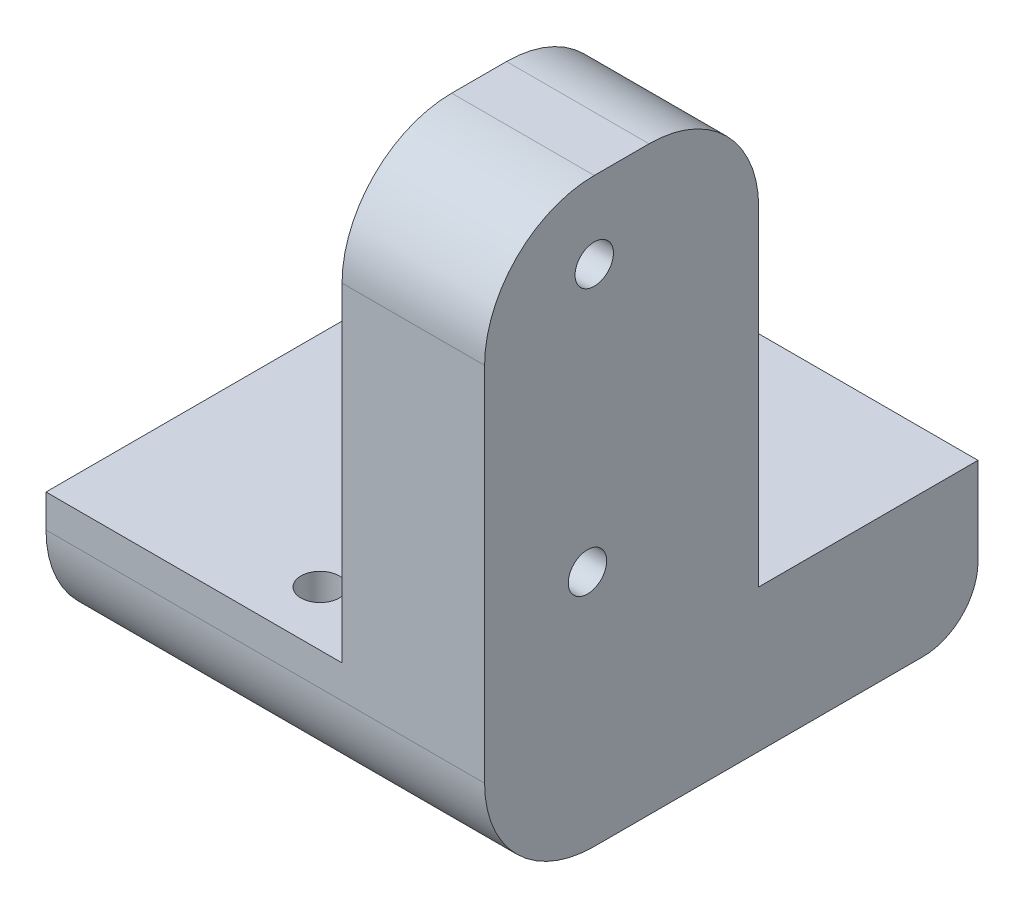
from build123d import *

# Parameters (mm, degrees)
SKETCH1_W           = 40
SKETCH1_H           = 50
BOSS_EXTRUDE1_DEPTH = 13
SKETCH2_W           = 13
SKETCH2_H           = 30
BOSS_EXTRUDE2_DEPTH = 40
SKETCH3_R           = 1.75
CUT_EXTRUDE1_DEPTH  = 32
SKETCH4_W           = 26
SKETCH4_H           = 50
CUT_EXTRUDE2_DEPTH  = 3
SKETCH5_R           = 1.75
CUT_EXTRUDE3_DEPTH  = 10
SKETCH6_W           = 40
SKETCH6_H           = 53
CUT_EXTRUDE4_DEPTH  = 5
FILLET1_R           = 10
FILLET2_R           = 10
FILLET3_R           = 10
FILLET4_R           = 5
SKETCH7_R           = 3.5
CUT_EXTRUDE5_DEPTH  = 5


with BuildPart() as part:
    # Sketch1 → Boss-Extrude1 (new body)
    with BuildSketch(Plane(origin=(0, 0, 0), x_dir=(1, 0, 0), z_dir=(0, 1, 0))):
        Rectangle(SKETCH1_W, SKETCH1_H)
    extrude(amount=BOSS_EXTRUDE1_DEPTH)

    # Sketch2 → Boss-Extrude2 (add)
    with BuildSketch(Plane(origin=(0, 13, 0), x_dir=(1, 0, 0), z_dir=(0, 1, 0))):
        with Locations((13.5, -10)):
            Rectangle(SKETCH2_W, SKETCH2_H)
    extrude(amount=BOSS_EXTRUDE2_DEPTH)

    # Sketch3 → Cut-Extrude1 (cut)
    with BuildSketch(Plane(origin=(20, 0, 0), x_dir=(0, 0, -1), z_dir=(1, 0, 0))):
        with Locations((-10, 46)):
            Circle(SKETCH3_R)
        with Locations((-10.616810137, 22)):
            Circle(SKETCH3_R)
    extrude(amount=-CUT_EXTRUDE1_DEPTH, mode=Mode.SUBTRACT)

    # Sketch4 → Cut-Extrude2 (cut)
    with BuildSketch(Plane(origin=(0, 0, 0), x_dir=(-1, 0, 0), z_dir=(0, -1, 0))):
        Rectangle(SKETCH4_W, SKETCH4_H)
    extrude(amount=-CUT_EXTRUDE2_DEPTH, mode=Mode.SUBTRACT)

    # Sketch5 → Cut-Extrude3 (cut)
    with BuildSketch(Plane(origin=(0, 3, 0), x_dir=(-1, 0, 0), z_dir=(0, -1, 0))):
        with Locations(Location((0, 0, 0), (0, 0, 90))):
            Circle(SKETCH5_R)
        with Locations(Location((0, -15, 0), (0, 0, 90))):
            Circle(SKETCH5_R)
        with Locations(Location((0, 15, 0), (0, 0, 90))):
            Circle(SKETCH5_R)
    extrude(amount=-CUT_EXTRUDE3_DEPTH, mode=Mode.SUBTRACT)

    # Sketch6 → Cut-Extrude4 (cut)
    with BuildSketch(Plane.XY.offset(25)):
        with Locations((0, 26.5)):
            Rectangle(SKETCH6_W, SKETCH6_H)
    extrude(amount=-CUT_EXTRUDE4_DEPTH, mode=Mode.SUBTRACT)

    # Fillet1
    fillet1_edges = [part.edges().sort_by_distance(p)[0] for p in [
        (13.5, 53, 20),
    ]]
    fillet(fillet1_edges, radius=FILLET1_R)

    # Fillet2
    fillet2_edges = [part.edges().sort_by_distance(p)[0] for p in [
        (13.5, 53, -5),
    ]]
    fillet(fillet2_edges, radius=FILLET2_R)

    # Fillet3
    fillet3_edges = [part.edges().sort_by_distance(p)[0] for p in [
        (-16.5, 0, 20),
    ]]
    fillet(fillet3_edges, radius=FILLET3_R)

    # Fillet4
    fillet4_edges = [part.edges().sort_by_distance(p)[0] for p in [
        (-16.5, 0, -25),
    ]]
    fillet(fillet4_edges, radius=FILLET4_R - 0.0001)  # a hair under: the kernel refuses the full size

    # Sketch7 → Cut-Extrude5 (cut)
    with BuildSketch(Plane.ZY.offset(-7)):
        with Locations((10.616810137, 22)):
            Circle(SKETCH7_R)
        with Locations((10, 46)):
            Circle(SKETCH7_R)
    extrude(amount=-CUT_EXTRUDE5_DEPTH, mode=Mode.SUBTRACT)


solid = part.part
